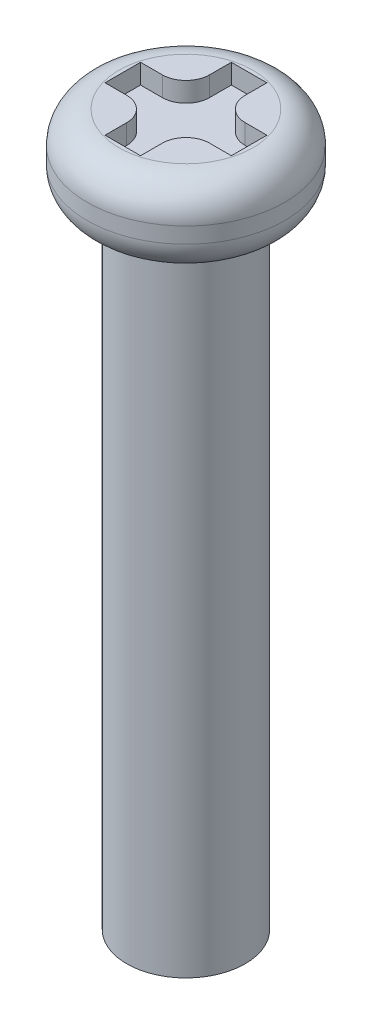
from build123d import *

# Parameters (mm, degrees)
SKETCH1_W           = 2.5
SKETCH1_H           = 2
FILLET2_R           = 0.8
SKETCH3_W           = 0.9
SKETCH3_H           = 3.2
CUT_EXTRUDE1_DEPTH  = 0.5
SKETCH4_W           = 3.2
SKETCH4_H           = 0.9
CUT_EXTRUDE2_DEPTH  = 4.840572939
FILLET1_R           = 0.6
SKETCH2_R           = 1.5
BOSS_EXTRUDE1_DEPTH = 16


with BuildPart() as part:
    # Sketch1 → Revolve1 (revolve)
    with BuildSketch(Plane(origin=(0, 0, 0), x_dir=(0, 0, -1), z_dir=(1, 0, 0))):
        with Locations((1.25, 1)):
            Rectangle(SKETCH1_W, SKETCH1_H)
    revolve(axis=Axis((0, 0, 0), (0, 1, 0)))

    # Fillet2
    fillet2_edges = [part.edges().sort_by_distance(p)[0] for p in [
        (0, 0, 2.5),
        (0, 2, 2.5),
    ]]
    fillet(fillet2_edges, radius=FILLET2_R)

    # Sketch3 → Cut-Extrude1 (cut)
    with BuildSketch(Plane(origin=(0, 2, 0), x_dir=(1, 0, 0), z_dir=(0, 1, 0))):
        Rectangle(SKETCH3_W, SKETCH3_H)
    extrude(amount=-CUT_EXTRUDE1_DEPTH, mode=Mode.SUBTRACT)

    # Sketch4 → Cut-Extrude2 (cut, through all)
    with BuildSketch(Plane(origin=(0, 1.5, 0), x_dir=(1, 0, 0), z_dir=(0, 1, 0))):
        Rectangle(SKETCH4_W, SKETCH4_H)
    extrude(amount=CUT_EXTRUDE2_DEPTH, mode=Mode.SUBTRACT)

    # Fillet1
    fillet1_edges = [part.edges().sort_by_distance(p)[0] for p in [
        (0.45, 1.75, 0.45),
        (-0.45, 1.75, 0.45),
        (0.45, 1.75, -0.45),
        (-0.45, 1.75, -0.45),
    ]]
    fillet(fillet1_edges, radius=FILLET1_R)

    # Sketch2 → Boss-Extrude1 (add)
    with BuildSketch(Plane.XZ):
        Circle(SKETCH2_R)
    extrude(amount=BOSS_EXTRUDE1_DEPTH)


solid = part.part
